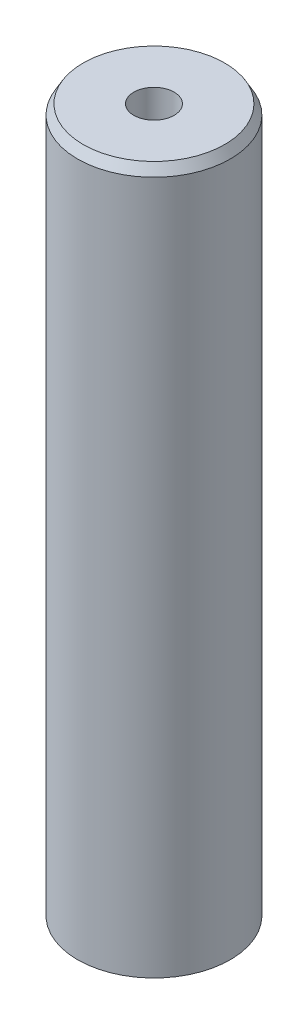
from build123d import *
from OCP.BRepFilletAPI import BRepFilletAPI_MakeChamfer

# Parameters (mm, degrees)
SKETCH1_R           = 7.5
BOSS_EXTRUDE1_DEPTH = 69.635234818
SKETCH2_R           = 1.980653265
CUT_EXTRUDE1_DEPTH  = 71.438383913
CHAMFER1_SIZE       = 0.955846251
CHAMFER1_SIZE2      = 0.55185809


with BuildPart() as part:
    # Sketch1 → Boss-Extrude1 (new body)
    with BuildSketch(Plane(origin=(0, 0, 0), x_dir=(1, 0, 0), z_dir=(0, 1, 0))):
        Circle(SKETCH1_R)
    extrude(amount=BOSS_EXTRUDE1_DEPTH)

    # Sketch2 → Cut-Extrude1 (cut, through all)
    with BuildSketch(Plane(origin=(0, 0, 0), x_dir=(1, 0, 0), z_dir=(0, 1, 0))):
        Circle(SKETCH2_R)
    extrude(amount=CUT_EXTRUDE1_DEPTH, mode=Mode.SUBTRACT)

    # Chamfer1: one chamfer whose edges measure the first distance from different faces: ONE call of the kernel's chamfer builder (chamfer() names one face for all edges)
    chamfer1_edges_1 = [part.edges().sort_by_distance(p)[0] for p in [
        (-7.5, 69.635234818, 0),
    ]]
    chamfer1_side_1 = [part.faces().sort_by_distance(p)[0] for p in [
        (-7.5, 34.817617409, 0),
    ]]
    chamfer1_edges_2 = [part.edges().sort_by_distance(p)[0] for p in [
        (-7.5, 0, 0),
    ]]
    chamfer1_side_2 = [part.faces().sort_by_distance(p)[0] for p in [
        (-7.287867966, 0, 0),
    ]]
    chamfer1 = BRepFilletAPI_MakeChamfer(part.part.solid().wrapped)
    for e in chamfer1_edges_1:
        chamfer1.Add(CHAMFER1_SIZE, CHAMFER1_SIZE2, e.wrapped, chamfer1_side_1[0].wrapped)  # the first distance lies on this face
    for e in chamfer1_edges_2:
        chamfer1.Add(CHAMFER1_SIZE, CHAMFER1_SIZE2, e.wrapped, chamfer1_side_2[0].wrapped)  # the first distance lies on this face
    add(Compound.cast(chamfer1.Shape()), mode=Mode.REPLACE)


solid = part.part
